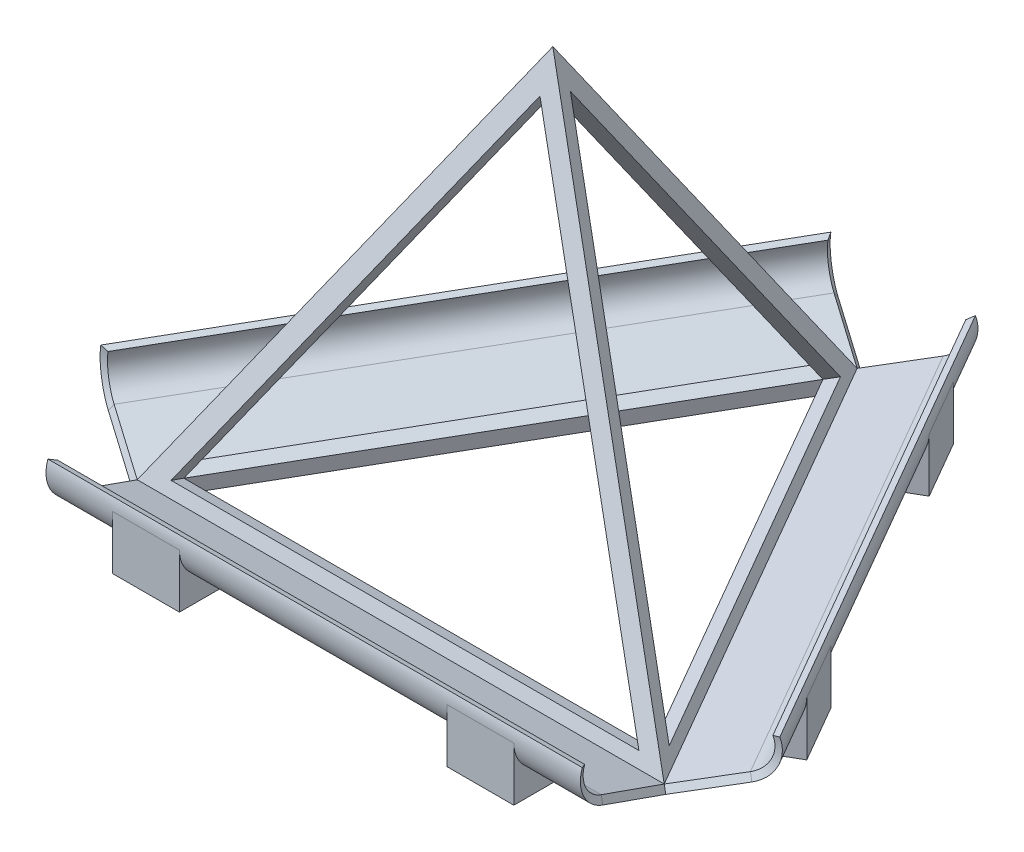
from build123d import *

# Parameters (mm, degrees)
BOSS_EXTRUDE1_DEPTH  = 82.956052622
CHAMFER1_SIZE        = 83.058
CHAMFER1_SIZE_2      = 29.329393675
BOSS_EXTRUDE3_START  = 2.592376644
BOSS_EXTRUDE3_DEPTH  = 72.586546044
CHAMFER6_SIZE        = 72.644
CHAMFER6_SIZE_2      = 25.663219438
BOSS_EXTRUDE19_DEPTH = 25.4
BOSS_EXTRUDE20_DEPTH = 25.4
BOSS_EXTRUDE21_DEPTH = 25.4
BOSS_EXTRUDE23_DEPTH = 25.4
BOSS_EXTRUDE26_START = 38.1
BOSS_EXTRUDE26_DEPTH = 12.7
BOSS_EXTRUDE27_START = -25.4
BOSS_EXTRUDE27_DEPTH = 12.7
MIRROR2_START        = 38.1
MIRROR2_COPY_2_DEPTH = 12.7
MIRROR2_START_2      = -25.4
MIRROR2_COPY_3_DEPTH = 12.7
MIRROR2_COPY_5_DEPTH = 12.7
MIRROR2_COPY_6_DEPTH = 12.7


with BuildPart() as part:
    # Sketch1 → Boss-Extrude1 (new body)
    with BuildSketch(Plane(origin=(0, 0, 0), x_dir=(1, 0, 0), z_dir=(0, 1, 0))):
        Polygon((-50.8, -29.329393675), (0, 58.65878735), (50.8, -29.329393675), align=None)
    extrude(amount=BOSS_EXTRUDE1_DEPTH)

    # Chamfer1
    # the kernel refuses this chamfer: 83.058, 29.329393675 mm, written as the material it takes off along each edge
    with BuildSketch(Plane(origin=(-158.547298904, 82.956052622, 215.953189756), x_dir=(-0.011114252752895883, -0.9999176455327007, -0.006416816818725978), z_dir=(0.5000000000000001, 0, -0.8660254037844387)), Plane(origin=(266.294597809, 82.956052622, 29.329393675), x_dir=(0, -0.9999176455327007, 0.012833633637452178), z_dir=(-1, 0, 0)), Plane(origin=(-107.747298904, 82.956052622, -245.28258343), x_dir=(0.011114252752896008, -0.9999176455327007, -0.006416816818726048), z_dir=(0.49999999999999994, 0, 0.8660254037844387))) as chamfer1_piece_1:
        Polygon((CHAMFER1_SIZE * 0.999917645533, -CHAMFER1_SIZE * 0.0128336336375), (-CHAMFER1_SIZE_2 * 0.0128336336374, -CHAMFER1_SIZE_2 * 0.999917645527), (0, 0), align=None)
    extrude(amount=532.589195618, mode=Mode.SUBTRACT)


with BuildPart() as body_2:
    # Sketch2 → Boss-Extrude3 (new body)
    with BuildSketch(Plane(origin=(0, 0, 0), x_dir=(1, 0, 0), z_dir=(0, 1, 0)).offset(BOSS_EXTRUDE3_START)):
        Polygon((-44.45, -25.663219465), (0, 51.326438931), (44.45, -25.663219465), align=None)
    extrude(amount=BOSS_EXTRUDE3_DEPTH)

    # Chamfer6
    # the kernel refuses this chamfer: 72.644, 25.663219438 mm, written as the material it takes off along each edge
    with BuildSketch(Plane(origin=(-94.237538797, 75.178922689, -214.550644108), x_dir=(0.011118590367512081, -0.9999175812357334, -0.0064193211416922824), z_dir=(0.5000000000000001, 0, 0.8660254037844386)), Plane(origin=(-138.687538797, 75.178922689, 188.887424643), x_dir=(-0.011118590367511921, -0.9999175812357334, -0.006419321141692186), z_dir=(0.49999999999999994, 0, -0.8660254037844387)), Plane(origin=(232.925077595, 75.178922689, 25.663219465), x_dir=(0, -0.9999175812357332, 0.012838642283384548), z_dir=(-1, 0, 0))) as chamfer6_piece_1:
        Polygon((CHAMFER6_SIZE * 0.999917581236, -CHAMFER6_SIZE * 0.0128386422834), (-CHAMFER6_SIZE_2 * 0.0128386422834, -CHAMFER6_SIZE_2 * 0.999917581236), (0, 0), align=None)
    extrude(amount=465.850155189, mode=Mode.SUBTRACT)

    # Sketch19 → Boss-Extrude19 (add)
    with BuildSketch(Plane(origin=(0, 8.341471254, 23.611918188), x_dir=(1, 0, 0), z_dir=(0, 0.3330989621400992, 0.9428918715426434))):
        Polygon((0, 70.885595133), (-44.414844608, -6.097300002), (44.414844608, -6.097300002), align=None)
    extrude(amount=BOSS_EXTRUDE19_DEPTH)

    # Sketch20 → Boss-Extrude20 (add)
    with BuildSketch(Plane(origin=(-20.448520983, 8.341471254, -11.805959094), x_dir=(-0.43652342739361594, 0.1780689969978707, 0.8818949651997697), z_dir=(-0.8165683137777828, 0.3330989621400992, -0.47144593577132166))):
        Polygon((13.387035379, 69.610019986), (42.464106341, -14.375505607), (-44.767106565, 2.400345516), align=None)
    extrude(amount=BOSS_EXTRUDE20_DEPTH)

    # Sketch21 → Boss-Extrude21 (add)
    with BuildSketch(Plane(origin=(20.448520983, 8.341471254, -11.805959094), x_dir=(-0.43652342739361605, -0.1780689969978708, -0.8818949651997696), z_dir=(0.8165683137777828, 0.3330989621400991, -0.47144593577132177))):
        Polygon((-13.387035361, 69.610020002), (-42.464106341, -14.375505607), (44.767106565, 2.400345516), align=None)
    extrude(amount=BOSS_EXTRUDE21_DEPTH)

    # Sketch22 → Boss-Extrude23 (add)
    with BuildSketch(Plane.XZ.offset(-2.592376644)):
        Polygon((44.414844608, 25.64292249), (-44.414844608, 25.64292249), (0, -51.285844981), align=None)
    extrude(amount=BOSS_EXTRUDE23_DEPTH)


with BuildPart() as part_1:
    add(part.part)

    # Combine3: cut body 2
    add(body_2.part, mode=Mode.SUBTRACT)

    # Sweep2: sweep along a path in Sketch25
    with BuildLine(Plane(origin=(0, 0, 0), x_dir=(0, 0, -1), z_dir=(1, 0, 0))) as sweep2_path:
        Line((-29.293394075, 0), (-41.26870121, 4.228713638))
        ThreePointArc((-41.26870121, 4.228713638), (-44.883330876, 7.477532809), (-45.141997958, 12.330724024))
    # Sketch24 → Sweep2 (sweep)
    with BuildSketch(Plane(origin=(0, 9.197233007, 26.045672391), x_dir=(1, 0, 0), z_dir=(0, 0.33296957778049097, 0.9429375696580775))):
        Polygon((-50.737646864, -9.753809057), (50.737646864, -9.753809057), (50.03399067, -8.533709325), (-50.03399067, -8.533709325), align=None)
    sweep2 = sweep(path=sweep2_path.line)

    # Sketch26 → Boss-Extrude26 (add)
    with BuildSketch(Plane(origin=(0, 0, 0), x_dir=(0, 0, -1), z_dir=(1, 0, 0)).offset(BOSS_EXTRUDE26_START)):
        with BuildLine():
            Line((-45.504344391, 10.216367205), (-45.504344391, 0))
            Line((-45.504344391, 0), (-29.293394075, 0))
            Line((-29.293394075, 0), (-41.26870121, 4.228713638))
            ThreePointArc((-41.26870121, 4.228713638), (-44.338390388, 6.549192939), (-45.504344391, 10.216367205))
        make_face()
    boss_extrude26 = extrude(amount=-BOSS_EXTRUDE26_DEPTH)

    # Sketch26<7> → Boss-Extrude27 (add)
    with BuildSketch(Plane(origin=(0, 0, 0), x_dir=(0, 0, -1), z_dir=(1, 0, 0)).offset(BOSS_EXTRUDE27_START)):
        with BuildLine():
            Line((-45.504344391, 10.216367205), (-45.504344391, 0))
            Line((-45.504344391, 0), (-29.293394075, 0))
            Line((-29.293394075, 0), (-41.26870121, 4.228713638))
            ThreePointArc((-41.26870121, 4.228713638), (-44.338390388, 6.549192939), (-45.504344391, 10.216367205))
        make_face()
    boss_extrude27 = extrude(amount=-BOSS_EXTRUDE27_DEPTH)

    # Mirror1: Sweep2, Boss-Extrude26, Boss-Extrude27 across plane
    add(sweep2.mirror(Plane(origin=(0, 0, 0), x_dir=(0.8660254037844387, 0, 0.49999999999999994), z_dir=(-0.49999999999999983, 0, 0.8660254037844387))))
    add(boss_extrude26.mirror(Plane(origin=(0, 0, 0), x_dir=(0.8660254037844387, 0, 0.49999999999999994), z_dir=(-0.49999999999999983, 0, 0.8660254037844387))))
    add(boss_extrude27.mirror(Plane(origin=(0, 0, 0), x_dir=(0.8660254037844387, 0, 0.49999999999999994), z_dir=(-0.49999999999999983, 0, 0.8660254037844387))))

    # Mirror2 copy 1: sweep along a path in Mirror2 copy 1 path
    with BuildLine(Plane(origin=(0, 0, 0), x_dir=(-0.8660254037844385, 0, 0.5), z_dir=(-0.5000000000000001, 0, -0.8660254037844388))) as mirror2_copy_1_path:
        Line((-29.293394075, 0), (-41.26870121, 4.228713638))
        ThreePointArc((-41.26870121, 4.228713638), (-44.883330876, 7.477532809), (-45.141997958, 12.330724024))
    # Mirror2 copy 1 sketch → Mirror2 copy 1 (sweep)
    with BuildSketch(Plane(origin=(22.55621395, 9.197233007, -13.022836196), x_dir=(-0.5000000000000001, 0, -0.8660254037844388), z_dir=(0.8166078895066538, 0.33296957778049074, -0.4714687848290388))):
        Polygon((-50.737646864, -9.753809057), (50.737646864, -9.753809057), (50.03399067, -8.533709325), (-50.03399067, -8.533709325), align=None)
    sweep(path=mirror2_copy_1_path.line)

    # Mirror2 copy 2 sketch → Mirror2 copy 2 (add)
    with BuildSketch(Plane(origin=(0, 0, 0), x_dir=(-0.8660254037844385, 0, 0.5), z_dir=(-0.5000000000000001, 0, -0.8660254037844388)).offset(MIRROR2_START)):
        with BuildLine():
            Line((-45.504344391, 10.216367205), (-45.504344391, 0))
            Line((-45.504344391, 0), (-29.293394075, 0))
            Line((-29.293394075, 0), (-41.26870121, 4.228713638))
            ThreePointArc((-41.26870121, 4.228713638), (-44.338390388, 6.549192939), (-45.504344391, 10.216367205))
        make_face()
    extrude(amount=-MIRROR2_COPY_2_DEPTH)

    # Mirror2 copy 3 sketch → Mirror2 copy 3 (add)
    with BuildSketch(Plane(origin=(0, 0, 0), x_dir=(-0.8660254037844385, 0, 0.5), z_dir=(-0.5000000000000001, 0, -0.8660254037844388)).offset(MIRROR2_START_2)):
        with BuildLine():
            Line((-45.504344391, 10.216367205), (-45.504344391, 0))
            Line((-45.504344391, 0), (-29.293394075, 0))
            Line((-29.293394075, 0), (-41.26870121, 4.228713638))
            ThreePointArc((-41.26870121, 4.228713638), (-44.338390388, 6.549192939), (-45.504344391, 10.216367205))
        make_face()
    extrude(amount=-MIRROR2_COPY_3_DEPTH)

    # Mirror2 copy 4: sweep along a path in Mirror2 copy 4 path
    with BuildLine(Plane(origin=(0, 0, 0), x_dir=(0.8660254037844389, 0, 0.4999999999999998), z_dir=(0.49999999999999956, 0, -0.8660254037844389))) as mirror2_copy_4_path:
        Line((-29.293394075, 0), (-41.26870121, -4.228713638))
        ThreePointArc((-41.26870121, -4.228713638), (-44.883330876, -7.477532809), (-45.141997958, -12.330724024))
    # Mirror2 copy 4 sketch → Mirror2 copy 4 (sweep)
    with BuildSketch(Plane(origin=(-22.55621395, 9.197233007, -13.022836196), x_dir=(0.49999999999999956, 0, -0.8660254037844389), z_dir=(-0.8166078895066541, 0.33296957778049086, -0.4714687848290386))):
        Polygon((-50.737646864, 9.753809057), (50.737646864, 9.753809057), (50.03399067, 8.533709325), (-50.03399067, 8.533709325), align=None)
    sweep(path=mirror2_copy_4_path.line)

    # Mirror2 copy 5 sketch → Mirror2 copy 5 (add)
    with BuildSketch(Plane(origin=(0, 0, 0), x_dir=(0.8660254037844389, 0, 0.4999999999999998), z_dir=(0.49999999999999956, 0, -0.8660254037844389)).offset(MIRROR2_START)):
        with BuildLine():
            Line((-45.504344391, -10.216367205), (-45.504344391, 0))
            Line((-45.504344391, 0), (-29.293394075, 0))
            Line((-29.293394075, 0), (-41.26870121, -4.228713638))
            ThreePointArc((-41.26870121, -4.228713638), (-44.338390388, -6.549192939), (-45.504344391, -10.216367205))
        make_face()
    extrude(amount=-MIRROR2_COPY_5_DEPTH)

    # Mirror2 copy 6 sketch → Mirror2 copy 6 (add)
    with BuildSketch(Plane(origin=(0, 0, 0), x_dir=(0.8660254037844389, 0, 0.4999999999999998), z_dir=(0.49999999999999956, 0, -0.8660254037844389)).offset(MIRROR2_START_2)):
        with BuildLine():
            Line((-45.504344391, -10.216367205), (-45.504344391, 0))
            Line((-45.504344391, 0), (-29.293394075, 0))
            Line((-29.293394075, 0), (-41.26870121, -4.228713638))
            ThreePointArc((-41.26870121, -4.228713638), (-44.338390388, -6.549192939), (-45.504344391, -10.216367205))
        make_face()
    extrude(amount=-MIRROR2_COPY_6_DEPTH)


solid = part_1.part
